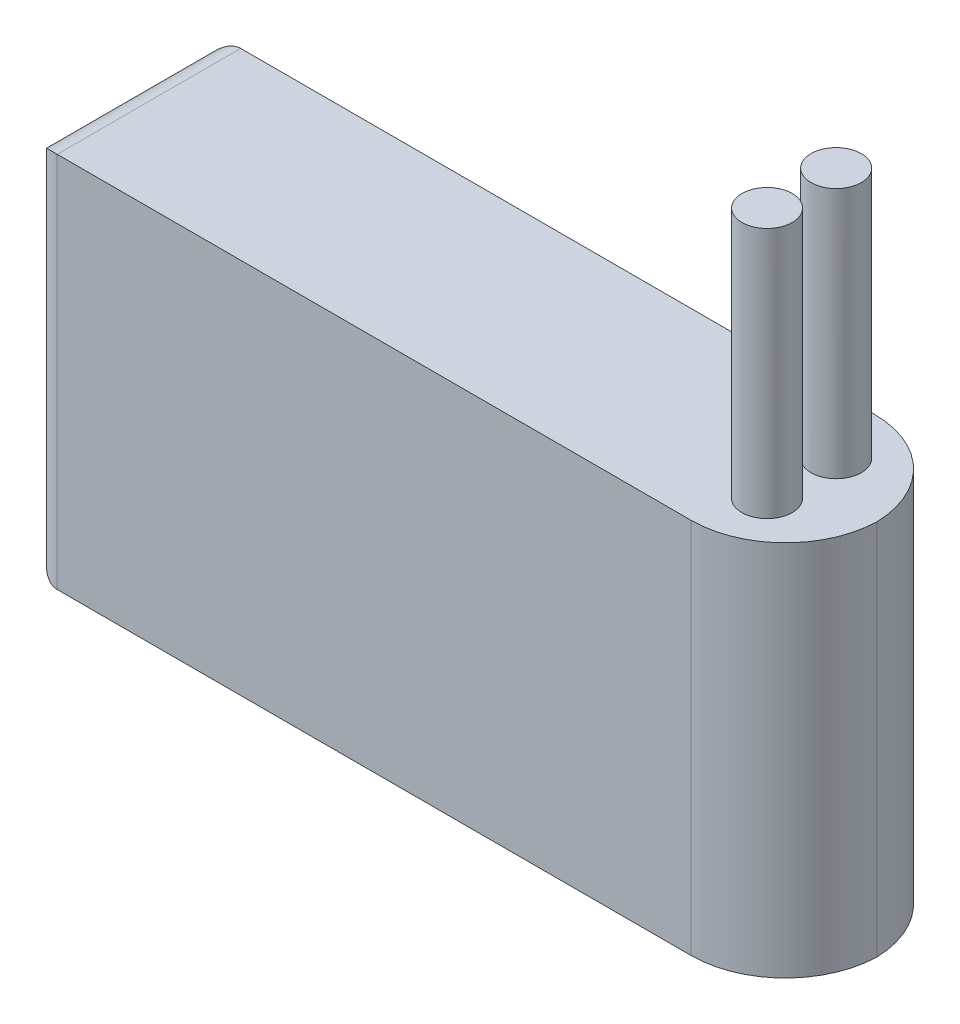
from build123d import *

# Parameters (mm, degrees)
SKETCH1_W           = 76.2
SKETCH1_H           = 38.1
BOSS_EXTRUDE1_DEPTH = 18.542
FILLET1_R           = 9.525
SKETCH2_R           = 2.54
BOSS_EXTRUDE2_DEPTH = 25.4
FILLET2_R           = 2.6035


with BuildPart() as part:
    # Sketch1 → Boss-Extrude1 (new body)
    with BuildSketch(Plane.XY):
        with Locations((38.1, 19.05)):
            Rectangle(SKETCH1_W, SKETCH1_H)
    extrude(amount=BOSS_EXTRUDE1_DEPTH)

    # Fillet1
    # the kernel refuses this fillet: 9.525 mm, written as the material it takes off along each edge
    with BuildSketch(Plane(origin=(76.2, -23.8125, 18.542), x_dir=(0, 0, -1), z_dir=(0, 1, 0))) as fillet1_piece_1:
        with BuildLine():
            CenterArc((FILLET1_R, FILLET1_R), FILLET1_R, 180, 90)
            Line((0, FILLET1_R), (0, 0))
            Line((0, 0), (FILLET1_R, 0))
        make_face()
    extrude(amount=85.725, mode=Mode.SUBTRACT)
    with BuildSketch(Plane(origin=(76.2, -23.8125, 0), x_dir=(0, 0, 1), z_dir=(0, 1, 0))) as fillet1_piece_2:
        with BuildLine():
            CenterArc((FILLET1_R, -FILLET1_R), FILLET1_R, 90, 90)
            Line((0, -FILLET1_R), (0, 0))
            Line((0, 0), (FILLET1_R, 0))
        make_face()
    extrude(amount=85.725, mode=Mode.SUBTRACT)

    # Sketch2 → Boss-Extrude2 (add)
    with BuildSketch(Plane(origin=(0, 38.1, 0), x_dir=(1, 0, 0), z_dir=(0, 1, 0))):
        with Locations(Location((68.576612731, -5.7785, 0), (0, 0, 90))):
            Circle(SKETCH2_R)
        with Locations(Location((68.576612731, -12.7635, 0), (0, 0, 90))):
            Circle(SKETCH2_R)
    extrude(amount=BOSS_EXTRUDE2_DEPTH)

    # Fillet2
    fillet2_edges = [part.edges().sort_by_distance(p)[0] for p in [
        (0, 19.05, 18.542),
        (0, 19.05, 0),
        (0, 38.1, 9.271),
        (0, 0, 9.271),
    ]]
    fillet(fillet2_edges, radius=FILLET2_R)


solid = part.part
